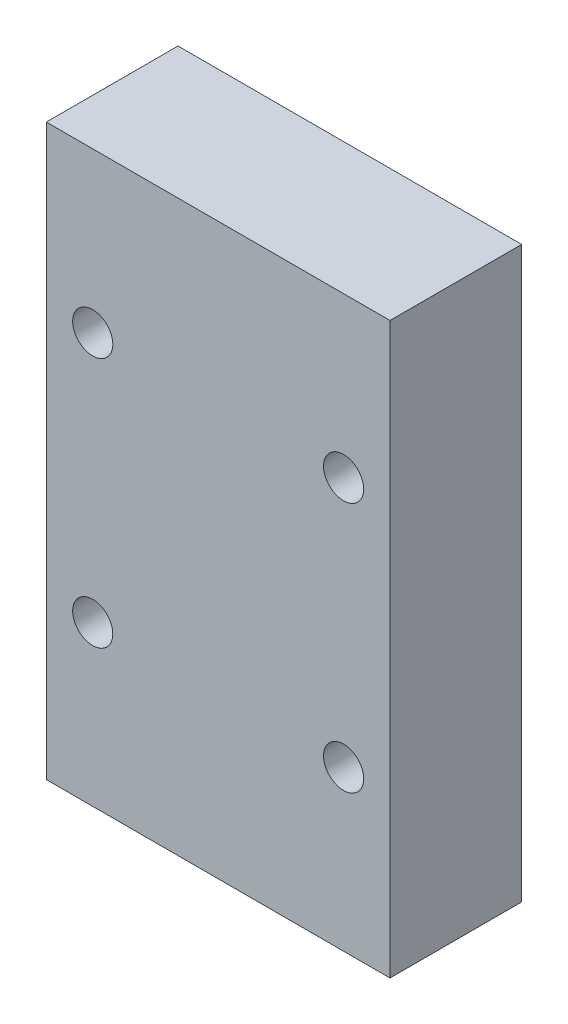
from build123d import *

# Parameters (mm, degrees)
BOSS_EXTRUDE1_DEPTH      = 5
BOSS_EXTRUDE1_DEPTH_BACK = 5.5
SKETCH1_W                = 27.4
SKETCH1_H                = 45.4
SKETCH1_R                = 1.6


with BuildPart() as part:
    # Sketch1 → Boss-Extrude1 (new, two sides: drawn at the far end of the back side and taken through both)
    with BuildSketch(Plane.XY.offset(-BOSS_EXTRUDE1_DEPTH_BACK)):
        with Locations((-94.811742501, 4.832442497)):
            Rectangle(SKETCH1_W, SKETCH1_H)
        with Locations((-104.811742501, -5.167557503)):
            Circle(SKETCH1_R, mode=Mode.SUBTRACT)
        with Locations((-104.811742501, 14.832442497)):
            Circle(SKETCH1_R, mode=Mode.SUBTRACT)
        with Locations((-84.811742501, 14.832442497)):
            Circle(SKETCH1_R, mode=Mode.SUBTRACT)
        with Locations((-84.811742501, -5.167557503)):
            Circle(SKETCH1_R, mode=Mode.SUBTRACT)
    extrude(amount=BOSS_EXTRUDE1_DEPTH + BOSS_EXTRUDE1_DEPTH_BACK)


solid = part.part
